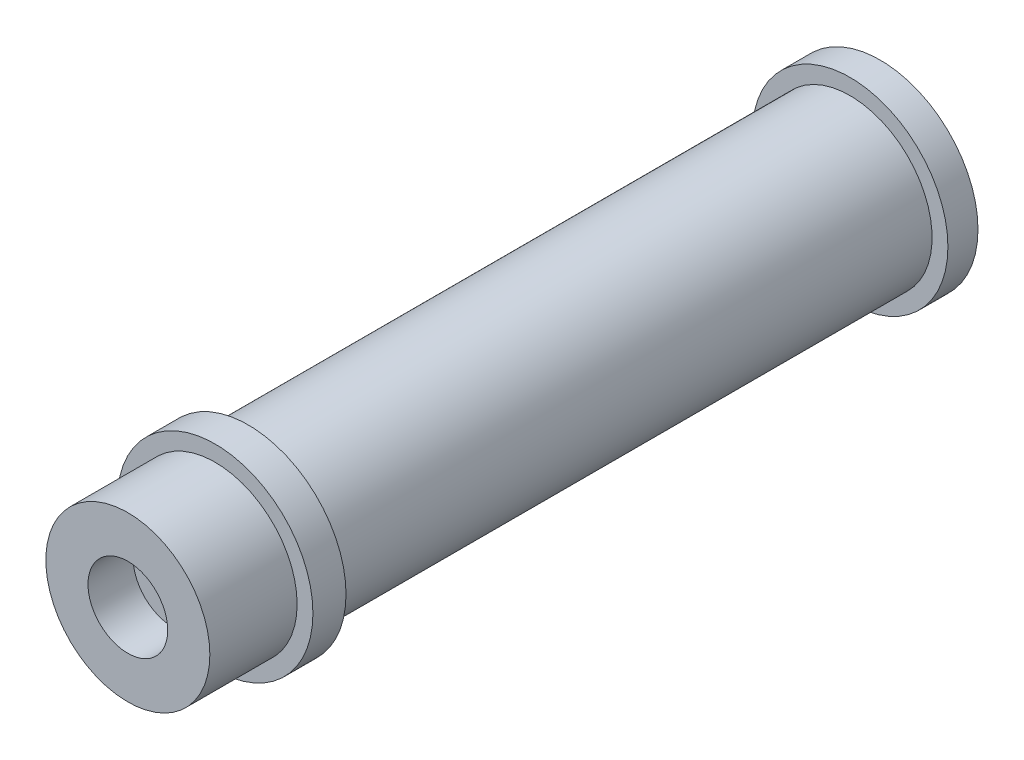
from build123d import *

# Parameters (mm, degrees)
SKETCH1_R           = 6.5
BOSS_EXTRUDE1_DEPTH = 50
SKETCH6_R           = 2.5
BOSS_EXTRUDE2_DEPTH = 2.5
SKETCH7_R           = 2.65
CUT_EXTRUDE1_DEPTH  = 3
SKETCH9_OUTSIDE_W   = 26.126
SKETCH9_OUTSIDE_H   = 26.126
SKETCH9_OUTSIDE_R   = 5.45
CUT_EXTRUDE2_DEPTH  = 5.8
CUT_EXTRUDE3_START  = -2
SKETCH11_OUTSIDE_W  = 26.126
SKETCH11_OUTSIDE_H  = 26.126
SKETCH11_OUTSIDE_R  = 5.45
CUT_EXTRUDE3_DEPTH  = 40


with BuildPart() as part:
    # Sketch1 → Boss-Extrude1 (new body)
    with BuildSketch(Plane.XY):
        Circle(SKETCH1_R)
    extrude(amount=BOSS_EXTRUDE1_DEPTH)

    # Sketch6 → Boss-Extrude2 (add)
    with BuildSketch(Plane(origin=(0, 0, 0), x_dir=(-1, 0, 0), z_dir=(0, 0, -1))):
        Circle(SKETCH6_R)
    extrude(amount=BOSS_EXTRUDE2_DEPTH)

    # Sketch7 → Cut-Extrude1 (cut)
    with BuildSketch(Plane.XY.offset(50)):
        Circle(SKETCH7_R)
    extrude(amount=-CUT_EXTRUDE1_DEPTH, mode=Mode.SUBTRACT)

    # Sketch9 outside → Cut-Extrude2 (cut)
    with BuildSketch(Plane.XY.offset(50)):
        Rectangle(SKETCH9_OUTSIDE_W, SKETCH9_OUTSIDE_H)
        Circle(SKETCH9_OUTSIDE_R, mode=Mode.SUBTRACT)
    extrude(amount=-CUT_EXTRUDE2_DEPTH, mode=Mode.SUBTRACT)

    # Sketch11 outside → Cut-Extrude3 (cut)
    with BuildSketch(Plane(origin=(0, 0, 0), x_dir=(-1, 0, 0), z_dir=(0, 0, -1)).offset(CUT_EXTRUDE3_START)):
        Rectangle(SKETCH11_OUTSIDE_W, SKETCH11_OUTSIDE_H)
        Circle(SKETCH11_OUTSIDE_R, mode=Mode.SUBTRACT)
    extrude(amount=-CUT_EXTRUDE3_DEPTH, mode=Mode.SUBTRACT)


solid = part.part
